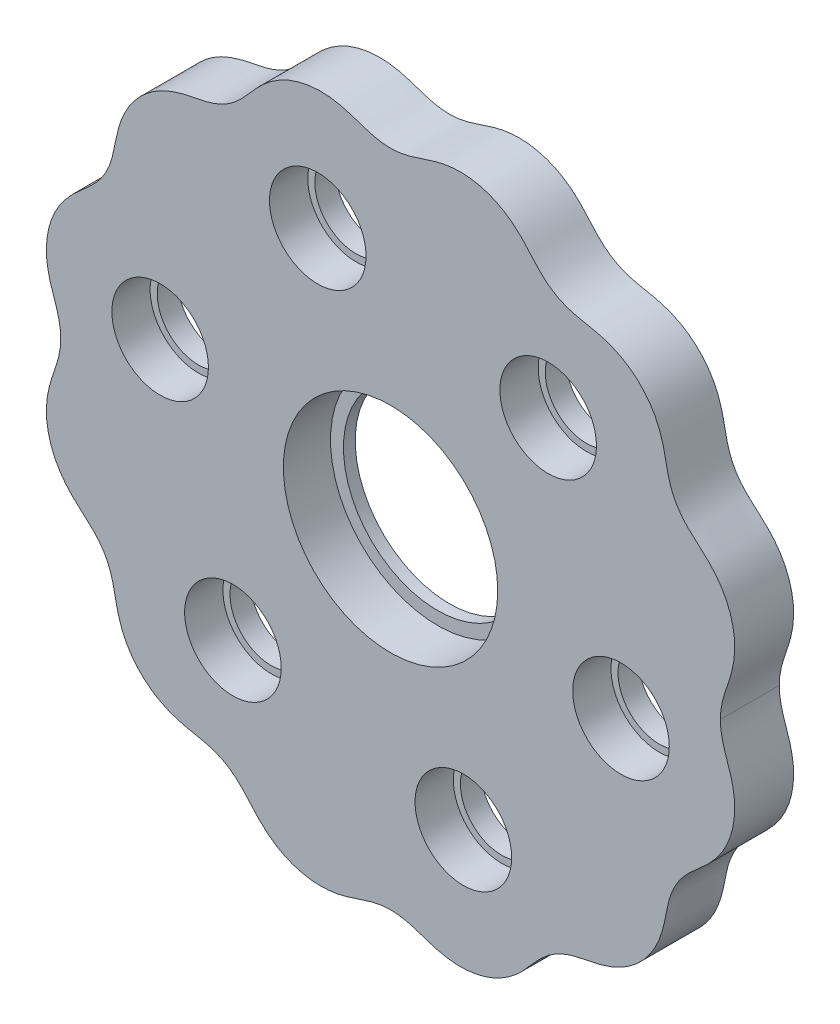
from build123d import *

# Parameters (mm, degrees)
BOSS_EXTRUDE1_DEPTH = 5
SKETCH5_R           = 9.1
CUT_EXTRUDE1_DEPTH  = 4
SKETCH6_R           = 8
CUT_EXTRUDE2_DEPTH  = 4
SKETCH7_R           = 4.1
CUT_EXTRUDE3_DEPTH  = 3.25
SKETCH8_R           = 3.5
CUT_EXTRUDE4_DEPTH  = 10


with BuildPart() as part:
    # Boss-Extrude1: read off the stored shape, not the designer's step
    # Boss-Extrude1 outline → Boss-Extrude1 (new body)
    with BuildSketch(Plane.XY):
        with BuildLine():
            add(Edge.make_bspline(
                [(-28, -6.29e-07), (-28.000000003, -0.02983365), (-28.000597891, -0.089626539), (-28.003288368, -0.208574631), (-28.010443823, -0.358296014), (-28.021129099, -0.497478972), (-28.035286515, -0.638042059), (-28.052838842, -0.779600747), (-28.07368907, -0.920362623), (-28.1109323, -1.137443527), (-28.172460627, -1.429714461), (-28.267823198, -1.79428308), (-28.403417207, -2.228569003), (-28.551443102, -2.662397725), (-28.701895511, -3.099170971), (-28.88092903, -3.653821492), (-29.076144869, -4.382058747), (-29.225035924, -5.293183629), (-29.242636392, -6.385132281), (-29.078888248, -7.515505435), (-28.736240754, -8.605125547), (-28.204495712, -9.664043971), (-27.50495183, -10.62095002), (-26.668353013, -11.458243252), (-25.750901936, -12.221018429), (-24.909200307, -13.01138102), (-24.212928723, -13.957224134), (-23.734598908, -15.029958866), (-23.46564848, -16.15305676), (-23.262341743, -17.343162836), (-22.955215303, -18.500998827), (-22.47025771, -19.598741792), (-21.808646094, -20.598710665), (-21.034057487, -21.438377421), (-20.135194621, -22.142557513), (-19.173070125, -22.674863767), (-18.1848113, -23.043385137), (-17.008911051, -23.330929651), (-15.816401117, -23.518551322), (-14.605437074, -23.872800143), (-13.534441757, -24.498170419), (-12.768281975, -25.16062656), (-12.124093583, -25.873424042), (-11.535815011, -26.566536844), (-10.861933868, -27.271410783), (-10.059597212, -27.93422734), (-9.125732684, -28.500446113), (-8.067203076, -28.929461856), (-6.953621623, -29.18351333), (-5.77104211, -29.258791955), (-4.591932769, -29.137476161), (-3.446910823, -28.836653139), (-2.313856017, -28.419585682), (-1.196157726, -28.077770272), (2.65e-07, -27.944508687), (1.19615809, -28.077771155), (2.313856477, -28.419584766), (3.446911017, -28.836656413), (4.591933415, -29.137472254), (5.771042166, -29.258798734), (6.953622593, -29.18350316), (8.0672025, -28.929478891), (9.125734587, -28.500416534), (10.059594746, -27.934275725), (10.861938581, -27.271326188), (11.535806076, -26.566700048), (12.124109152, -25.873139784), (12.768257554, -25.161074739), (13.534480401, -24.497470193), (14.413536978, -23.985814416), (15.369345941, -23.648151534), (16.314454966, -23.441584325), (17.223368133, -23.277357609), (18.184774521, -23.044067259), (19.173093033, -22.674454737), (20.135181499, -22.142804808), (21.034065799, -21.438231043), (21.808641528, -20.59879691), (22.470260843, -19.598684385), (22.955213046, -18.501036747), (23.262342804, -17.343137392), (23.465647405, -16.153070516), (23.734599269, -15.029950644), (24.21292871, -13.957228341), (24.909200967, -13.011377899), (25.750902477, -12.221020373), (26.668353733, -11.458242002), (27.504952345, -10.620950514), (28.204496137, -9.664043352), (28.736240977, -8.605125426), (29.078888317, -7.515504907), (29.242636266, -6.385131952), (29.225035635, -5.293183156), (29.07614444, -4.382058382), (28.880928524, -3.653821128), (28.701894972, -3.09917056), (28.551442568, -2.6623975), (28.403416705, -2.228568363), (28.26782276, -1.794283178), (28.17246026, -1.429713361), (28.110932001, -1.137443964), (28.073688824, -0.920361255), (28.052838632, -0.779602286), (28.035286341, -0.638026543), (28.022898635, -0.515108879), (28.014450689, -0.410381436), (28.007760445, -0.30225806), (28.002839903, -0.188690642), (28.000597866, -0.089619771), (27.999999995, -0.029833196), (28, -1.75e-07)],
                knots=[0.080339862, 0.080339862, 0.080339862, 0.080339862, 0.080339862, 0.08159206, 0.082844253, 0.084096446, 0.085348639, 0.086600832, 0.087853025, 0.089105218, 0.090357411, 0.09436331, 0.098369208, 0.102375107, 0.106381006, 0.110512123, 0.11464324, 0.122905474, 0.132921289, 0.142937783, 0.152954263, 0.162970812, 0.172987144, 0.184503844, 0.194518385, 0.204532926, 0.215048941, 0.225070204, 0.235586116, 0.245600673, 0.25561523, 0.267634078, 0.277649881, 0.287665956, 0.297682, 0.307697803, 0.317713803, 0.326226703, 0.334739603, 0.350259595, 0.360280295, 0.370299509, 0.37806034, 0.385821171, 0.394083001, 0.402344831, 0.41236111, 0.422377471, 0.432393848, 0.442410116, 0.452426384, 0.463943657, 0.47395909, 0.483974523, 0.494992005, 0.505008005, 0.516025487, 0.52604092, 0.536056353, 0.547573626, 0.557589894, 0.567606162, 0.577622539, 0.5876389, 0.597655179, 0.605917009, 0.614178839, 0.62193967, 0.6297005, 0.639719715, 0.649740414, 0.65750041, 0.665260407, 0.673773307, 0.682286207, 0.692302207, 0.70231801, 0.712334054, 0.722350129, 0.732365931, 0.74438478, 0.754399337, 0.764413894, 0.774929805, 0.784951069, 0.795467084, 0.805481625, 0.815496166, 0.827012865, 0.837029198, 0.847045746, 0.857062227, 0.86707872, 0.877094536, 0.88535677, 0.889487887, 0.893619004, 0.897624903, 0.901630801, 0.9056367, 0.909642599, 0.910894792, 0.912146985, 0.913399178, 0.914651371, 0.915903564, 0.91652966, 0.917155757, 0.91840795, 0.919660143, 0.919660143, 0.919660143, 0.919660143, 0.919660143], degree=4))
            add(Edge.make_bspline(
                [(28, -1.75e-07), (27.999999995, 0.029832846), (28.000597866, 0.08961942), (28.002839901, 0.188690291), (28.007760443, 0.302257709), (28.014450686, 0.410381085), (28.022898631, 0.515108529), (28.035286336, 0.638026193), (28.052838626, 0.779601936), (28.073688816, 0.920360905), (28.110931992, 1.137443615), (28.172460249, 1.429713012), (28.267822745, 1.79428283), (28.403416687, 2.228568016), (28.551442546, 2.662397154), (28.701894947, 3.099170216), (28.880928495, 3.653820785), (29.076144404, 4.38205804), (29.225035592, 5.293182815), (29.242636214, 6.385131612), (29.078888256, 7.515504565), (28.736240908, 8.605125082), (28.204496059, 9.664043003), (27.504952259, 10.62095016), (26.66835364, 11.458241641), (25.750902378, 12.221020005), (24.909200862, 13.011377523), (24.212928597, 13.95722796), (23.734599147, 15.029950259), (23.465647274, 16.153070128), (23.262342664, 17.343137003), (22.955212896, 18.501036355), (22.470260684, 19.59868399), (21.808641361, 20.598796509), (21.034065625, 21.438230636), (20.135181319, 22.142804394), (19.173092849, 22.674454315), (18.184774334, 23.044066829), (17.223367944, 23.277357171), (16.314454776, 23.44158388), (15.36934575, 23.648151081), (14.413536783, 23.985813955), (13.534480202, 24.497469725), (12.76825735, 25.161074265), (12.124108943, 25.873139305), (11.535805861, 26.566699564), (10.86193836, 27.271325699), (10.05959452, 27.934275229), (9.125734356, 28.500416031), (8.067202266, 28.929478379), (6.953622356, 29.183502639), (5.771041929, 29.258798203), (4.591933179, 29.137471714), (3.446910784, 28.836655864), (2.313856247, 28.419584208), (1.196157862, 28.077770587), (3.9e-08, 27.94450811), (-1.196157953, 28.077769684), (-2.313856247, 28.419585086), (-3.446911056, 28.836652534), (-4.591933006, 29.137475546), (-5.771042347, 29.258791331), (-6.953621859, 29.183512697), (-8.06720331, 28.929461213), (-9.125732915, 28.500445461), (-10.059597439, 27.934226681), (-10.861934089, 27.271410118), (-11.535815226, 26.566536173), (-12.124093793, 25.873423366), (-12.768282179, 25.160625879), (-13.534441956, 24.498169732), (-14.605437268, 23.872799447), (-15.816401308, 23.518550616), (-17.00891124, 23.330928936), (-18.184811486, 23.043384412), (-19.173070309, 22.674863034), (-20.135194801, 22.142556773), (-21.03405766, 21.438376673), (-21.808646261, 20.598709911), (-22.470257869, 19.598741032), (-22.955215453, 18.500998064), (-23.262341883, 17.34316207), (-23.465648611, 16.153055992), (-23.734599029, 15.029958097), (-24.212928836, 13.95722336), (-24.909200413, 13.01138024), (-25.750902035, 12.221017643), (-26.668353106, 11.458242458), (-27.504951916, 10.62094922), (-28.204495791, 9.664043165), (-28.736240824, 8.605124737), (-29.078888309, 7.515504621), (-29.242636444, 6.385131467), (-29.225035967, 5.293182814), (-29.076144904, 4.382057933), (-28.88092906, 3.653820681), (-28.701895536, 3.099170161), (-28.551443123, 2.662396917), (-28.403417225, 2.228568195), (-28.267823213, 1.794282274), (-28.172460638, 1.429713655), (-28.110932309, 1.137442722), (-28.073689077, 0.920361818), (-28.052838848, 0.779599942), (-28.03528652, 0.638041254), (-28.021129103, 0.497478168), (-28.010443826, 0.358295209), (-28.003288369, 0.208573826), (-28.000597891, 0.089625735), (-28.000000004, 0.029832846), (-28, -6.29e-07)],
                knots=[0.080339862, 0.080339862, 0.080339862, 0.080339862, 0.080339862, 0.081592055, 0.082844248, 0.083470345, 0.084096441, 0.085348634, 0.086600827, 0.08785302, 0.089105213, 0.090357406, 0.094363305, 0.098369204, 0.102375102, 0.106381001, 0.110512118, 0.114643235, 0.122905469, 0.132921285, 0.142937778, 0.152954259, 0.162970807, 0.17298714, 0.184503839, 0.19451838, 0.204532921, 0.215048936, 0.2250702, 0.235586111, 0.245600668, 0.255615225, 0.267634074, 0.277649876, 0.287665951, 0.297681995, 0.307697798, 0.317713798, 0.326226698, 0.334739598, 0.342499594, 0.350259591, 0.36028029, 0.370299504, 0.378060335, 0.385821166, 0.394082996, 0.402344826, 0.412361105, 0.422377466, 0.432393843, 0.442410111, 0.452426379, 0.463943652, 0.473959085, 0.483974518, 0.494992, 0.505008, 0.516025482, 0.526040915, 0.536056348, 0.547573621, 0.557589889, 0.567606157, 0.577622534, 0.587638895, 0.597655174, 0.605917004, 0.614178834, 0.621939665, 0.629700496, 0.63971971, 0.649740409, 0.665260402, 0.673773302, 0.682286202, 0.692302202, 0.702318005, 0.712334049, 0.722350124, 0.732365926, 0.744384775, 0.754399332, 0.764413889, 0.7749298, 0.784951064, 0.795467079, 0.80548162, 0.815496161, 0.82701286, 0.837029193, 0.847045741, 0.857062222, 0.867078715, 0.877094531, 0.885356765, 0.889487882, 0.893618999, 0.897624898, 0.901630796, 0.905636695, 0.909642594, 0.910894787, 0.91214698, 0.913399173, 0.914651366, 0.915903559, 0.917155752, 0.918407945, 0.919660143, 0.919660143, 0.919660143, 0.919660143, 0.919660143], degree=4))
        make_face()
    extrude(amount=BOSS_EXTRUDE1_DEPTH)

    # Sketch5 → Cut-Extrude1 (cut)
    with BuildSketch(Plane.XY.offset(5)):
        Circle(SKETCH5_R)
    extrude(amount=-CUT_EXTRUDE1_DEPTH, mode=Mode.SUBTRACT)

    # Sketch6 → Cut-Extrude2 (cut)
    with BuildSketch(Plane.XY.offset(1)):
        Circle(SKETCH6_R)
    extrude(amount=-CUT_EXTRUDE2_DEPTH, mode=Mode.SUBTRACT)

    # Sketch7 → Cut-Extrude3 (cut)
    with BuildSketch(Plane.XY.offset(5)):
        with Locations((-13.382628625, -14.862881655)):
            Circle(SKETCH7_R)
        with Locations((-19.562947399, 4.158255531)):
            Circle(SKETCH7_R)
        with Locations((-6.180318774, 19.021137186)):
            Circle(SKETCH7_R)
        with Locations((13.382628625, 14.862881655)):
            Circle(SKETCH7_R)
        with Locations((19.562947399, -4.158255531)):
            Circle(SKETCH7_R)
        with Locations((6.180318774, -19.021137186)):
            Circle(SKETCH7_R)
    extrude(amount=-CUT_EXTRUDE3_DEPTH, mode=Mode.SUBTRACT)

    # Sketch8 → Cut-Extrude4 (cut)
    with BuildSketch(Plane.XY.offset(1.75)):
        with Locations((-13.382628625, -14.862881655)):
            Circle(SKETCH8_R)
        with Locations((-19.562947399, 4.158255531)):
            Circle(SKETCH8_R)
        with Locations((-6.180318774, 19.021137186)):
            Circle(SKETCH8_R)
        with Locations((13.382628625, 14.862881655)):
            Circle(SKETCH8_R)
        with Locations((19.562947399, -4.158255531)):
            Circle(SKETCH8_R)
        with Locations((6.180318774, -19.021137186)):
            Circle(SKETCH8_R)
    extrude(amount=-CUT_EXTRUDE4_DEPTH, mode=Mode.SUBTRACT)


solid = part.part
